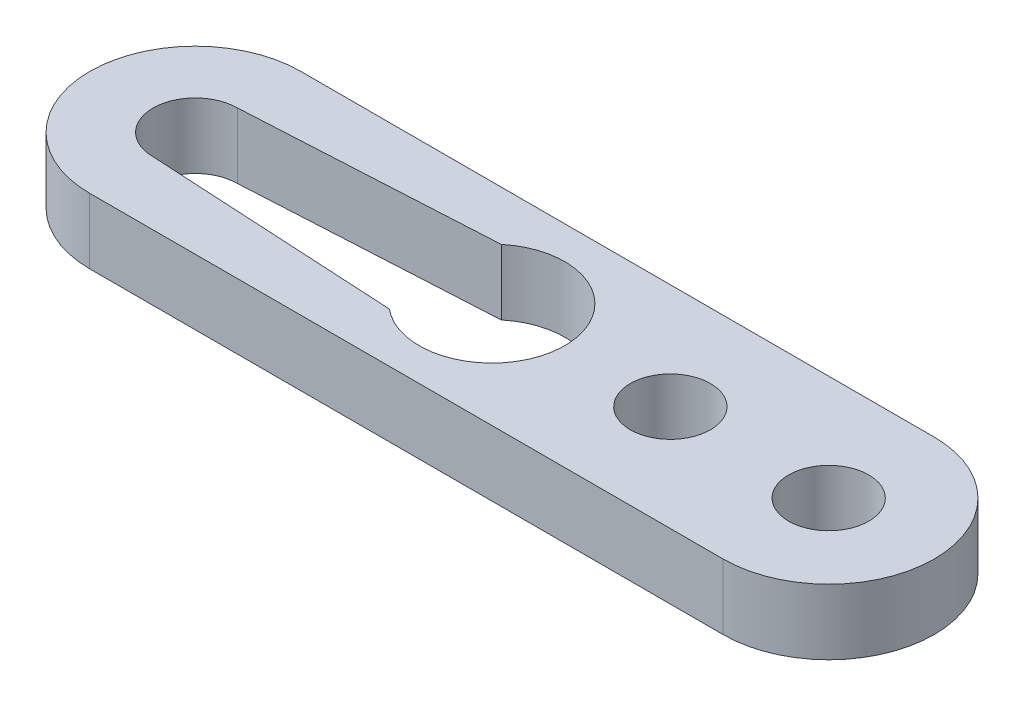
from build123d import *

# Parameters (mm, degrees)
BOSS_EXTRUDE1_DEPTH      = 3
BOSS_EXTRUDE1_DEPTH_BACK = 0.1
F_6_CLEARANCE_HOLE1_D    = 3.7973


with BuildPart() as part:
    # Sketch1 → Boss-Extrude1 (new, two sides: drawn at the far end of the back side and taken through both)
    with BuildSketch(Plane(origin=(0, 0, 0), x_dir=(1, 0, 0), z_dir=(0, 1, 0)).offset(-BOSS_EXTRUDE1_DEPTH_BACK)):
        with BuildLine():
            Line((-15, 5), (15, 5))
            ThreePointArc((15, 5), (20, 0), (15, -5))
            Line((15, -5), (-15, -5))
            ThreePointArc((-15, -5), (-20, 0), (-15, 5))
        make_face()
        with BuildLine():
            Line((-15, 2), (-3.159072307, 2.649999913))
            ThreePointArc((-3.159072307, 2.649999913), (2.5, 0), (-3.159072307, -2.649999913))
            Line((-3.159072307, -2.649999913), (-15, -2))
            ThreePointArc((-15, -2), (-17, 0), (-15, 2))
        make_face(mode=Mode.SUBTRACT)
    extrude(amount=BOSS_EXTRUDE1_DEPTH + BOSS_EXTRUDE1_DEPTH_BACK)

    # #6 Clearance Hole1 (through all)
    with Locations(Plane(origin=(0, 3, 0), x_dir=(1, 0, 0), z_dir=(0, 1, 0))):
        with Locations((7.5, 0), (15, 0)):
            Hole(F_6_CLEARANCE_HOLE1_D / 2)


solid = part.part
